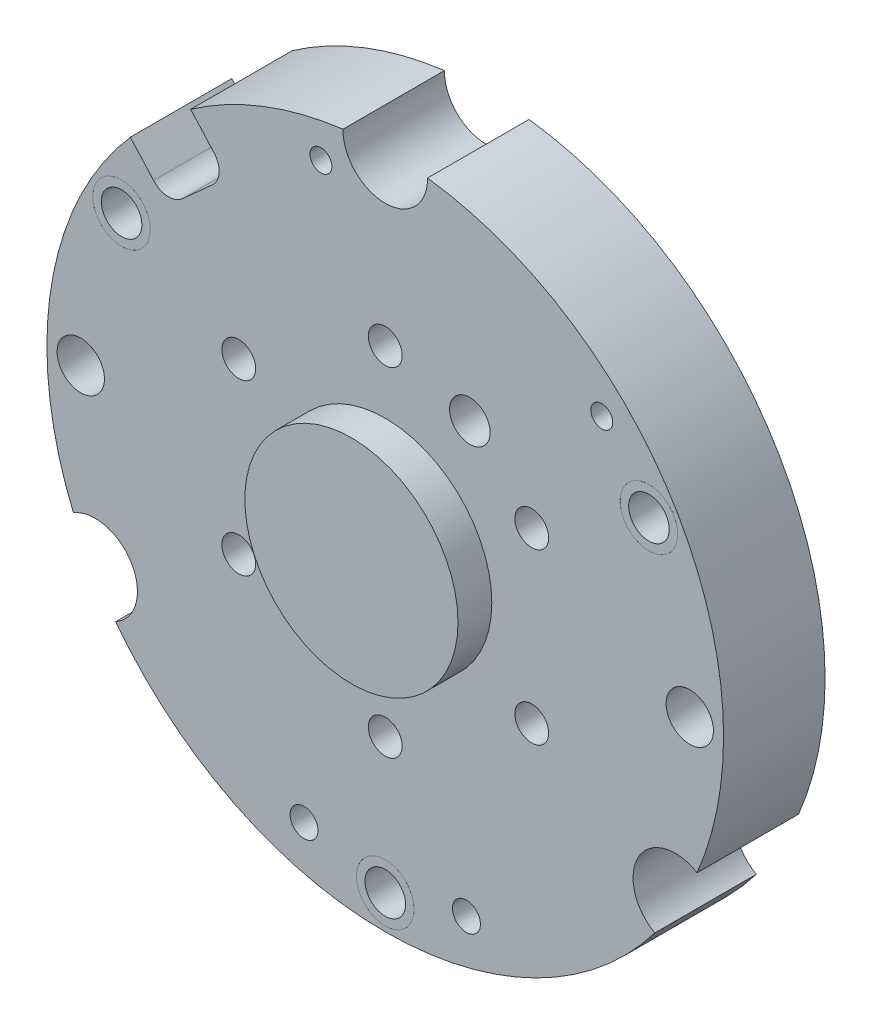
from build123d import *

# Parameters (mm, degrees)
ESTRUSIONE_ESTRUSIONE1_DEPTH   = 15
TAGLIO_ESTRUSIONE1_DEPTH       = 15
SCHIZZO3_R                     = 5.5
TAGLIO_ESTRUSIONE2_DEPTH       = 5
ESTRUSIONE_ESTRUSIONE2_DEPTH   = 5
SCHIZZO6_R                     = 35
TAGLIO_ESTRUSIONE3_DEPTH       = 0.3
SCHIZZO7_R                     = 4.25
SCHIZZO7_R_2                   = 3
ESTRUSIONE_ESTRUSIONE3_DEPTH   = 15
ESTRUSIONE_ESTRUSIONE3_2_DEPTH = 15
ESTRUSIONE_ESTRUSIONE3_3_DEPTH = 15


with BuildPart() as part:
    # Schizzo1 → Estrusione-Estrusione1 (new body)
    with BuildSketch(Plane.XY):
        with BuildLine():
            Line((-34.235180936, 29.055161096), (-37.673638759, 32.873955385))
            ThreePointArc((-37.673638759, 32.873955385), (-49.364560322, 7.946079802), (-46.086634111, -19.391290734))
            ThreePointArc((-46.086634111, -19.391290734), (-37.457286225, -21.625095267), (-39.837731078, -30.215148231))
            ThreePointArc((-39.837731078, -30.215148231), (0, -50), (39.837731078, -30.215148231))
            ThreePointArc((39.837731078, -30.215148231), (37.457286225, -21.625095267), (46.086634111, -19.391290734))
            ThreePointArc((46.086634111, -19.391290734), (43.301043643, 25.000392386), (6.249067596, 49.607954545))
            ThreePointArc((6.249067596, 49.607954545), (0, 43.25), (-6.249067596, 49.607954545))
            ThreePointArc((-6.249067596, 49.607954545), (-18.035485511, 46.633906789), (-28.755900853, 40.903522662))
            Line((-28.755900853, 40.903522662), (-25.31744303, 37.084728372))
            ThreePointArc((-25.31744303, 37.084728372), (-24.550988902, 34.920328684), (-25.539485687, 32.847902076))
            Line((-25.539485687, 32.847902076), (-29.99835464, 28.833118438))
            ThreePointArc((-29.99835464, 28.833118438), (-32.162754328, 28.06666431), (-34.235180936, 29.055161096))
        make_face()
        with BuildLine():
            ThreePointArc((32, 30.379), (33.621, 32), (32, 33.621))
            ThreePointArc((32, 33.621), (30.379, 32), (32, 30.379))
        make_face(mode=Mode.SUBTRACT)
        with BuildLine():
            ThreePointArc((-12, -44.067), (-9.933, -42), (-12, -39.933))
            ThreePointArc((-12, -39.933), (-14.067, -42), (-12, -44.067))
        make_face(mode=Mode.SUBTRACT)
        with BuildLine():
            ThreePointArc((12, -44.067), (14.067, -42), (12, -39.933))
            ThreePointArc((12, -39.933), (9.933, -42), (12, -44.067))
        make_face(mode=Mode.SUBTRACT)
        with BuildLine():
            ThreePointArc((-38.97, 26.75), (-43.22, 22.5), (-38.97, 18.25))
            ThreePointArc((-38.97, 18.25), (-34.72, 22.5), (-38.97, 26.75))
        make_face(mode=Mode.SUBTRACT)
        with BuildLine():
            ThreePointArc((38.97, 26.75), (34.72, 22.5), (38.97, 18.25))
            ThreePointArc((38.97, 18.25), (43.22, 22.5), (38.97, 26.75))
        make_face(mode=Mode.SUBTRACT)
        with BuildLine():
            ThreePointArc((0, -40.75), (-4.25, -45), (0, -49.25))
            ThreePointArc((0, -49.25), (4.25, -45), (0, -40.75))
        make_face(mode=Mode.SUBTRACT)
        with BuildLine():
            ThreePointArc((-45, -3.5), (-41.5, 0), (-45, 3.5))
            ThreePointArc((-45, 3.5), (-48.5, 0), (-45, -3.5))
        make_face(mode=Mode.SUBTRACT)
        with BuildLine():
            ThreePointArc((45, -3.5), (48.5, 0), (45, 3.5))
            ThreePointArc((45, 3.5), (41.5, 0), (45, -3.5))
        make_face(mode=Mode.SUBTRACT)
        with BuildLine():
            ThreePointArc((-9.5, 42.379), (-7.879, 44), (-9.5, 45.621))
            ThreePointArc((-9.5, 45.621), (-11.121, 44), (-9.5, 42.379))
        make_face(mode=Mode.SUBTRACT)
    extrude(amount=ESTRUSIONE_ESTRUSIONE1_DEPTH)

    # Schizzo2 → Taglio-Estrusione1 (cut)
    with BuildSketch(Plane.XY.offset(15)):
        with BuildLine():
            ThreePointArc((-2.165063509, -23.75), (-1.25, -27.165063509), (2.165063509, -26.25))
            ThreePointArc((2.165063509, -26.25), (1.25, -22.834936491), (-2.165063509, -23.75))
        make_face()
        with BuildLine():
            ThreePointArc((19.485571585, -11.25), (20.400635095, -14.665063509), (23.815698604, -13.75))
            ThreePointArc((23.815698604, -13.75), (22.900635095, -10.334936491), (19.485571585, -11.25))
        make_face()
        with BuildLine():
            ThreePointArc((19.485571585, 13.75), (20.400635095, 10.334936491), (23.815698604, 11.25))
            ThreePointArc((23.815698604, 11.25), (22.900635095, 14.665063509), (19.485571585, 13.75))
        make_face()
        with BuildLine():
            ThreePointArc((9.901923789, 23.150635095), (11, 19.052558883), (15.098076211, 20.150635095))
            ThreePointArc((15.098076211, 20.150635095), (14, 24.248711306), (9.901923789, 23.150635095))
        make_face()
        with BuildLine():
            ThreePointArc((-23.815698604, -11.25), (-22.900635095, -14.665063509), (-19.485571585, -13.75))
            ThreePointArc((-19.485571585, -13.75), (-20.400635095, -10.334936491), (-23.815698604, -11.25))
        make_face()
        with BuildLine():
            ThreePointArc((-2.165063509, 26.25), (-1.25, 22.834936491), (2.165063509, 23.75))
            ThreePointArc((2.165063509, 23.75), (1.25, 27.165063509), (-2.165063509, 26.25))
        make_face()
        with BuildLine():
            ThreePointArc((-23.815698604, 13.75), (-22.900635095, 10.334936491), (-19.485571585, 11.25))
            ThreePointArc((-19.485571585, 11.25), (-20.400635095, 14.665063509), (-23.815698604, 13.75))
        make_face()
    extrude(amount=-TAGLIO_ESTRUSIONE1_DEPTH, mode=Mode.SUBTRACT)

    # Schizzo3 → Taglio-Estrusione2 (cut)
    with BuildSketch(Plane(origin=(0, 0, 0), x_dir=(-1, 0, 0), z_dir=(0, 0, -1))):
        with Locations((0, 25)):
            Circle(SCHIZZO3_R)
        with Locations((21.650635095, 12.5)):
            Circle(SCHIZZO3_R)
        with Locations((21.650635095, -12.5)):
            Circle(SCHIZZO3_R)
        with Locations((0, -25)):
            Circle(SCHIZZO3_R)
        with Locations((-21.650635095, -12.5)):
            Circle(SCHIZZO3_R)
        with Locations((-21.650635095, 12.5)):
            Circle(SCHIZZO3_R)
    extrude(amount=-TAGLIO_ESTRUSIONE2_DEPTH, mode=Mode.SUBTRACT)

    # Schizzo6 → Taglio-Estrusione3 (cut)
    with BuildSketch(Plane(origin=(0, 0, 0), x_dir=(-1, 0, 0), z_dir=(0, 0, -1))):
        Circle(SCHIZZO6_R)
    extrude(amount=-TAGLIO_ESTRUSIONE3_DEPTH, mode=Mode.SUBTRACT)


with BuildPart() as body_2:
    # Schizzo5 → Estrusione-Estrusione2 (new body)
    with BuildSketch(Plane.XY.offset(15)):
        with BuildLine():
            ThreePointArc((13.63990011, -7.875), (7.875, 13.63990011), (-13.63990011, 7.875))
            ThreePointArc((-13.63990011, 7.875), (-7.875, -13.63990011), (13.63990011, -7.875))
        make_face()
    extrude(amount=ESTRUSIONE_ESTRUSIONE2_DEPTH)


with BuildPart() as body_3:
    # Schizzo7 → Estrusione-Estrusione3 (new body)
    with BuildSketch(Plane(origin=(0, 0, 0), x_dir=(-1, 0, 0), z_dir=(0, 0, -1))):
        with Locations((38.97, 22.5)):
            Circle(SCHIZZO7_R)
        with Locations((38.97, 22.5)):
            Circle(SCHIZZO7_R_2, mode=Mode.SUBTRACT)
    extrude(amount=-ESTRUSIONE_ESTRUSIONE3_DEPTH)


with BuildPart() as body_4:
    # Schizzo7 → Estrusione-Estrusione3 2 (new body)
    with BuildSketch(Plane(origin=(0, 0, 0), x_dir=(-1, 0, 0), z_dir=(0, 0, -1))):
        with Locations((0, -45)):
            Circle(SCHIZZO7_R)
        with Locations((0.000571585, -44.999009985)):
            Circle(SCHIZZO7_R_2, mode=Mode.SUBTRACT)
    extrude(amount=-ESTRUSIONE_ESTRUSIONE3_2_DEPTH)


with BuildPart() as body_5:
    # Schizzo7 → Estrusione-Estrusione3 3 (new body)
    with BuildSketch(Plane(origin=(0, 0, 0), x_dir=(-1, 0, 0), z_dir=(0, 0, -1))):
        with Locations((-38.97, 22.5)):
            Circle(SCHIZZO7_R)
        with Locations((-38.970571585, 22.499009985)):
            Circle(SCHIZZO7_R_2, mode=Mode.SUBTRACT)
    extrude(amount=-ESTRUSIONE_ESTRUSIONE3_3_DEPTH)


solid = Compound([part.part, body_2.part, body_3.part, body_4.part, body_5.part])
